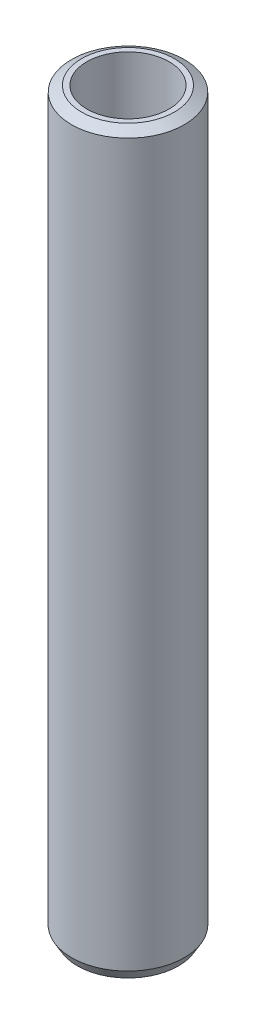
from build123d import *
from OCP.BRepFilletAPI import BRepFilletAPI_MakeChamfer

# Parameters (mm, degrees)
SKETCH1_R           = 17.5
BOSS_EXTRUDE1_DEPTH = 228.569906533
SKETCH2_R           = 12.739723171
CUT_EXTRUDE1_DEPTH  = 230.90585502
CHAMFER1_SIZE       = 1.803137376
CHAMFER1_SIZE2      = 3.123125548


with BuildPart() as part:
    # Sketch1 → Boss-Extrude1 (new body)
    with BuildSketch(Plane(origin=(0, 0, 0), x_dir=(1, 0, 0), z_dir=(0, 1, 0))):
        Circle(SKETCH1_R)
    extrude(amount=BOSS_EXTRUDE1_DEPTH)

    # Sketch2 → Cut-Extrude1 (cut, through all)
    with BuildSketch(Plane(origin=(0, 0, 0), x_dir=(1, 0, 0), z_dir=(0, 1, 0))):
        Circle(SKETCH2_R)
    extrude(amount=CUT_EXTRUDE1_DEPTH, mode=Mode.SUBTRACT)

    # Chamfer1: one chamfer whose edges measure the first distance from different faces: ONE call of the kernel's chamfer builder (chamfer() names one face for all edges)
    chamfer1_edges_1 = [part.edges().sort_by_distance(p)[0] for p in [
        (-17.5, 228.569906533, 0),
    ]]
    chamfer1_side_1 = [part.faces().sort_by_distance(p)[0] for p in [
        (-17.5, 114.284953267, 0),
    ]]
    chamfer1_edges_2 = [part.edges().sort_by_distance(p)[0] for p in [
        (-17.5, 0, 0),
    ]]
    chamfer1_side_2 = [part.faces().sort_by_distance(p)[0] for p in [
        (-17.005025253, 0, 0),
    ]]
    chamfer1 = BRepFilletAPI_MakeChamfer(part.part.solid().wrapped)
    for e in chamfer1_edges_1:
        chamfer1.Add(CHAMFER1_SIZE, CHAMFER1_SIZE2, e.wrapped, chamfer1_side_1[0].wrapped)  # the first distance lies on this face
    for e in chamfer1_edges_2:
        chamfer1.Add(CHAMFER1_SIZE, CHAMFER1_SIZE2, e.wrapped, chamfer1_side_2[0].wrapped)  # the first distance lies on this face
    add(Compound.cast(chamfer1.Shape()), mode=Mode.REPLACE)


solid = part.part
